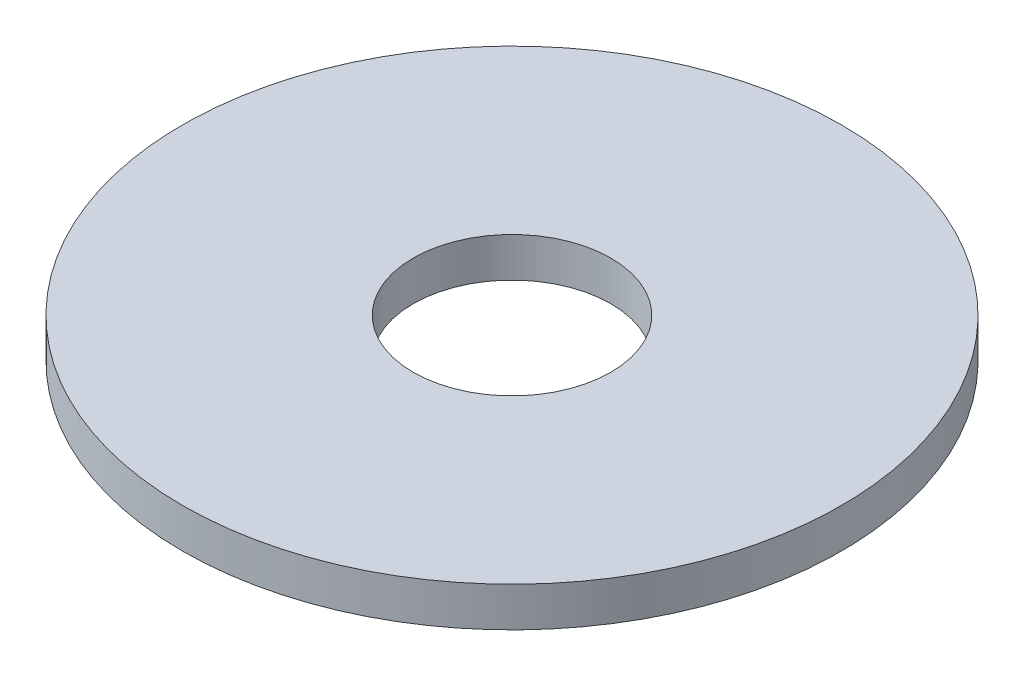
from build123d import *

# Parameters (mm, degrees)
SKETCH1_R           = 75
BOSS_EXTRUDE1_DEPTH = 9
SKETCH2_R           = 22.5
CUT_EXTRUDE1_DEPTH  = 107.447169995


with BuildPart() as part:
    # Sketch1 → Boss-Extrude1 (new body)
    with BuildSketch(Plane(origin=(0, 0, 0), x_dir=(1, 0, 0), z_dir=(0, 1, 0))):
        Circle(SKETCH1_R)
    extrude(amount=BOSS_EXTRUDE1_DEPTH)

    # Sketch2 → Cut-Extrude1 (cut, through all)
    with BuildSketch(Plane(origin=(0, 0, 0), x_dir=(1, 0, 0), z_dir=(0, 1, 0))):
        Circle(SKETCH2_R)
    extrude(amount=CUT_EXTRUDE1_DEPTH, mode=Mode.SUBTRACT)


solid = part.part
